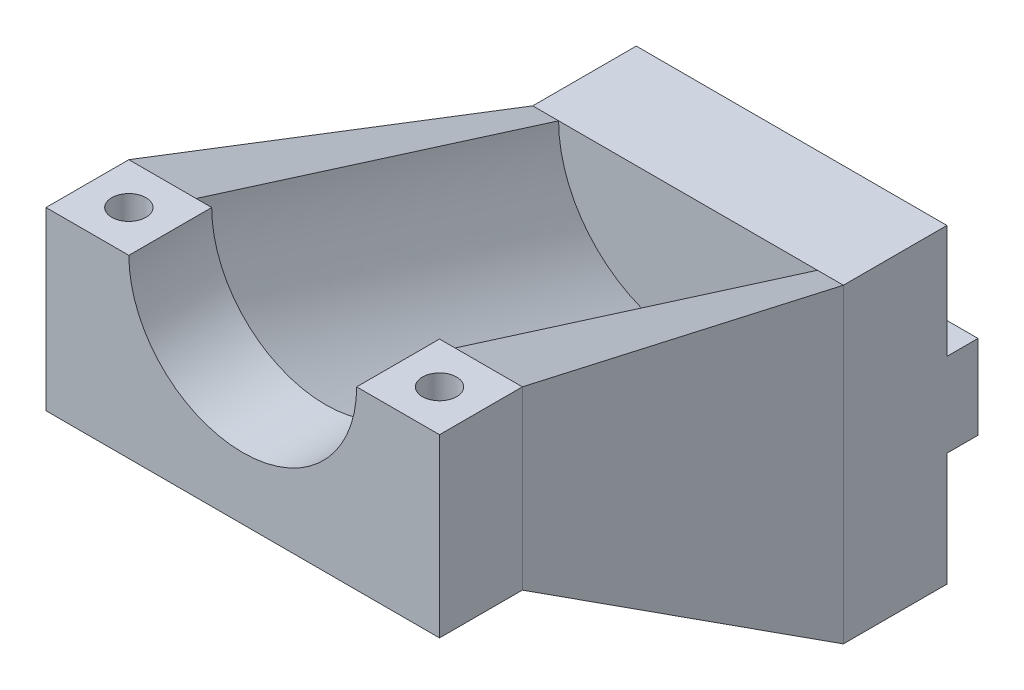
from build123d import *

# Parameters (mm, degrees)
SKETCH_1_W          = 30
SKETCH_1_H          = 30
EXTRUDE_1_DEPTH     = 10
EXTRUDE_3_DEPTH     = 8
SKETCH_11_R         = 3.5
CUT_EXTRUDE_2_DEPTH = 69.45436447
SKETCH_12_W         = 5
SKETCH_12_H         = 8.1
EXTRUDE_4_DEPTH     = 3


with BuildPart() as part:
    # 草图1 → 凸台-拉伸1 (new body)
    with BuildSketch(Plane.XY):
        with Locations((15, 15)):
            Rectangle(SKETCH_1_W, SKETCH_1_H)
    extrude(amount=EXTRUDE_1_DEPTH)

    # 高级异型孔1: read off the stored shape, not the designer's step
    # 高级异型孔1 outline → 高级异型孔1 (revolve, cut)
    with BuildSketch(Plane(origin=(15, 15, 0), x_dir=(1, 0, 0), z_dir=(0, -1, 0))):
        Polygon((3.15, 10), (0, 10), (0, 0), (1.7, 0), (1.7, 8.55), align=None)
    revolve(axis=Axis((15, 15, 0), (0, 0, 1)), mode=Mode.SUBTRACT)



with BuildPart() as body_2:
    # 草图2 → 凸台-拉伸3 (new body)
    with BuildSketch(Plane.XY.offset(45)):
        with BuildLine():
            Line((-4, 41), (4, 41))
            ThreePointArc((4, 41), (15, 30), (26, 41))
            Line((26, 41), (34, 41))
            Line((34, 41), (34, 24))
            Line((34, 24), (-4, 24))
            Line((-4, 24), (-4, 41))
        make_face()
    extrude(amount=EXTRUDE_3_DEPTH)


with BuildPart() as part_1:
    add(part.part)

    add(body_2.part)  # 放样2 merges body 2
    # 草图3 → 放样2 section 0
    with BuildSketch(Plane(origin=(0, 0, 45), x_dir=(-1, 0, 0), z_dir=(0, 0, -1))):
        with BuildLine():
            Line((-34, 41), (-27.5, 41))
            ThreePointArc((-27.5, 41), (-15, 28.5), (-2.5, 41))
            Line((-2.5, 41), (4, 41))
            Line((4, 41), (4, 24))
            Line((4, 24), (-34, 24))
            Line((-34, 24), (-34, 41))
        make_face()
    # 草图5 → 放样2 section 1
    with BuildSketch(Plane.XY.offset(10)):
        with BuildLine():
            Line((27.5, 30), (30, 30))
            Line((30, 30), (30, 0))
            Line((30, 0), (0, 0))
            Line((0, 0), (0, 30))
            Line((0, 30), (2.5, 30))
            ThreePointArc((2.5, 30), (15, 17.5), (27.5, 30))
        make_face()
    loft()

    # 草图11 → 切除-拉伸2 (cut, through all)
    with BuildSketch(Plane(origin=(0, 0, 10), x_dir=(-1, 0, 0), z_dir=(0, 0, -1))):
        with Locations(Location((-15, 15, 0), (0, 0, 50.487533502))):
            Circle(SKETCH_11_R)
    extrude(amount=-CUT_EXTRUDE_2_DEPTH, mode=Mode.SUBTRACT)

    # 草图12 → 凸台-拉伸4 (add)
    with BuildSketch(Plane(origin=(0, 0, 0), x_dir=(-1, 0, 0), z_dir=(0, 0, -1))):
        with Locations((-27.5, 15)):
            Rectangle(SKETCH_12_W, SKETCH_12_H)
        with Locations((-2.5, 15)):
            Rectangle(SKETCH_12_W, SKETCH_12_H)
    extrude(amount=EXTRUDE_4_DEPTH)

    # 高级异型孔4: read off the stored shape, not the designer's step
    # 高级异型孔4 outline → 高级异型孔4 (revolve, cut)
    with BuildSketch(Plane(origin=(30, 0, 49), x_dir=(1, 0, 0), z_dir=(0, 0, 1))):
        Polygon((0, 30.008579979), (1.65, 31), (1.65, 41), (0, 41), align=None)
    revolve(axis=Axis((30, 0, 49), (0, 1, 0)), mode=Mode.SUBTRACT)

    # Other 4 2 outline → Other 4 2 (revolve, cut)
    with BuildSketch(Plane.XY.offset(49)):
        Polygon((0, 30.008579979), (1.65, 31), (1.65, 41), (0, 41), align=None)
    revolve(axis=Axis((0, 0, 49), (0, 1, 0)), mode=Mode.SUBTRACT)


solid = part_1.part
